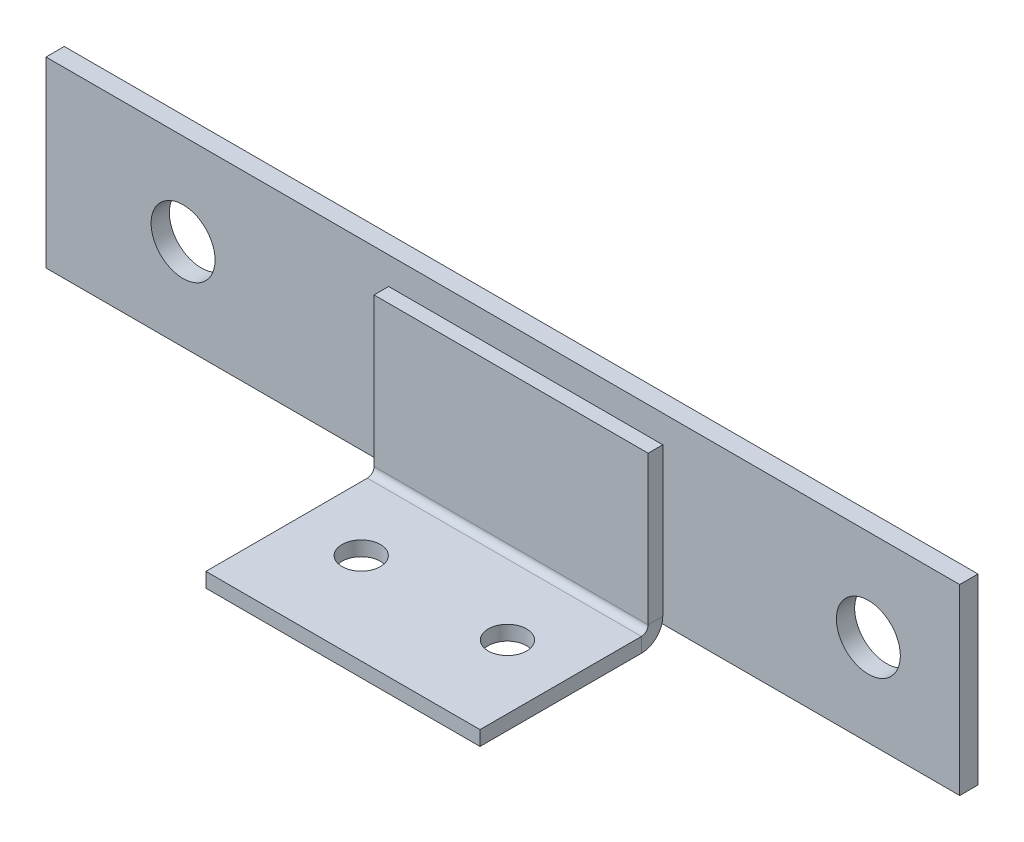
from build123d import *

# Parameters (mm, degrees)
SKETCH_1_W                       = 100
SKETCH_1_H                       = 20
EXTRUDE_1_DEPTH                  = 2
SKETCH_2_W                       = 30
SKETCH_2_H                       = 17
SM_BASE_FLANGE_1_DEPTH           = 1.6
SKETCH_11_R                      = 3.5
CUT_EXTRUDE_2_DEPTH              = 55.004629431
SM_EDGE_FLANGE_1_STRIP_W         = 7.8732
SM_EDGE_FLANGE_1_STRIP_H         = 1.6
SM_EDGE_FLANGE_1_STRIP_CUT_DEPTH = 30
SM_EDGE_FLANGE_1_DEPTH           = 30
SKETCH_15_R                      = 2.1
CUT_EXTRUDE_3_DEPTH              = 10


# Sheet-metal steps are written as plain solids
with BuildPart() as part:
    # Sketch 1 → 凸台-拉伸1 (new body)
    with BuildSketch(Plane.XY):
        with Locations((-2.5, 2.5)):
            Rectangle(SKETCH_1_W, SKETCH_1_H)
    extrude(amount=EXTRUDE_1_DEPTH)

    # 草图11 → 切除-拉伸2 (cut, through all)
    with BuildSketch(Plane.XY.offset(2)):
        with Locations((-37.5, 2.5)):
            Circle(SKETCH_11_R)
        with Locations((37.5, 2.5)):
            Circle(SKETCH_11_R)
    extrude(amount=-CUT_EXTRUDE_2_DEPTH, mode=Mode.SUBTRACT)


with BuildPart() as body_2:
    # 草图2 → 基体-法兰1 (new body)
    with BuildSketch(Plane.XY.offset(2)):
        with Locations((0, 1)):
            Rectangle(SKETCH_2_W, SKETCH_2_H)
    extrude(amount=SM_BASE_FLANGE_1_DEPTH)

    # 边线-法兰1 strip (across the edge) → 边线-法兰1 strip cut (cut)
    with BuildSketch(Plane(origin=(-15, -7.5, 3.6), x_dir=(0, 1, 0), z_dir=(1, 0, 0))):
        with Locations((-3.2, -0.8)):
            Rectangle(SM_EDGE_FLANGE_1_STRIP_W, SM_EDGE_FLANGE_1_STRIP_H)
    extrude(amount=SM_EDGE_FLANGE_1_STRIP_CUT_DEPTH, mode=Mode.SUBTRACT)

    # 边线-法兰1 section (across the edge) → 边线-法兰1 (add)
    with BuildSketch(Plane(origin=(-15, -7.5, 3.6), x_dir=(0, 1, 0), z_dir=(1, 0, 0))):
        with BuildLine():
            Line((-1.6, 0.7366), (-1.6, 18.4))
            Line((-1.6, 18.4), (0, 18.4))
            Line((0, 18.4), (0, 0.7366))
            ThreePointArc((0, 0.7366), (0.215745145, 0.215745145), (0.7366, 0))
            Line((0.7366, 0), (0.7366, -1.6))
            ThreePointArc((0.7366, -1.6), (-0.915625705, -0.915625705), (-1.6, 0.7366))
        make_face()
    extrude(amount=SM_EDGE_FLANGE_1_DEPTH)

    # 草图15 → 切除-拉伸3 (cut)
    with BuildSketch(Plane(origin=(0, -7.5, 0), x_dir=(1, 0, 0), z_dir=(0, 1, 0))):
        with Locations(Location((-8, -12, 0), (0, 0, 270))):
            Circle(SKETCH_15_R)
        with Locations(Location((8, -12, 0), (0, 0, 270))):
            Circle(SKETCH_15_R)
    extrude(amount=-CUT_EXTRUDE_3_DEPTH, mode=Mode.SUBTRACT)


solid = Compound([part.part, body_2.part])
